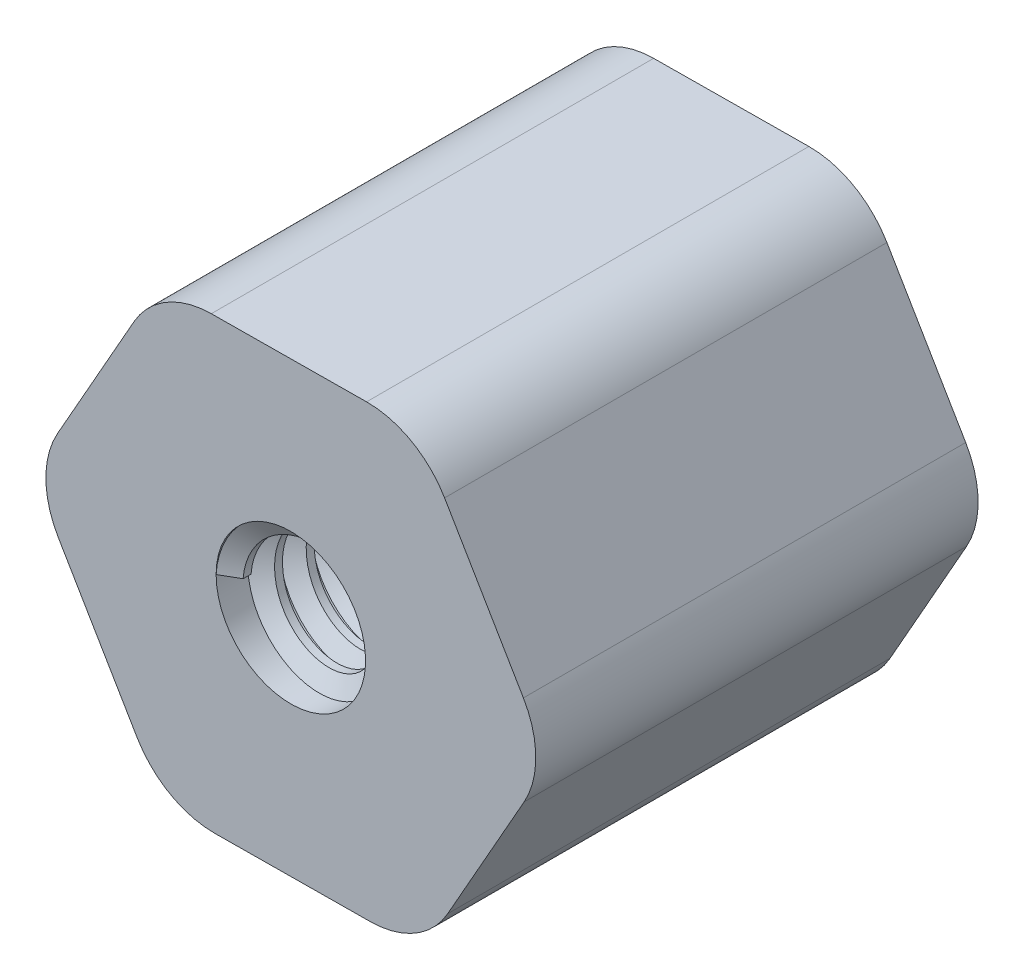
from build123d import *

# Parameters (mm, degrees)
CROQUIS1_R              = 2.5
SALIENTE_EXTRUIR1_DEPTH = 14.8
ROSCA1_PITCH            = 1.058333333


with BuildPart() as part:
    # Croquis1 → Saliente-Extruir1 (new body)
    with BuildSketch(Plane.XY):
        with BuildLine():
            Line((2.534265047, 7.52180169), (-2.661699853, 7.477656979))
            ThreePointArc((-2.661699853, 7.477656979), (-4.158231115, 7.063004214), (-5.246938823, 5.955638756))
            Line((-5.246938823, 5.955638756), (-7.806690831, 1.433728799))
            ThreePointArc((-7.806690831, 1.433728799), (-8.195856634, -0.069631673), (-7.78120387, -1.566162934))
            Line((-7.78120387, -1.566162934), (-5.144990978, -6.043928179))
            ThreePointArc((-5.144990978, -6.043928179), (-4.037625519, -7.132635887), (-2.534265047, -7.52180169))
            Line((-2.534265047, -7.52180169), (2.661699853, -7.477656979))
            ThreePointArc((2.661699853, -7.477656979), (4.158231115, -7.063004214), (5.246938823, -5.955638756))
            Line((5.246938823, -5.955638756), (7.806690831, -1.433728799))
            ThreePointArc((7.806690831, -1.433728799), (8.195856634, 0.069631673), (7.78120387, 1.566162934))
            Line((7.78120387, 1.566162934), (5.144990978, 6.043928179))
            ThreePointArc((5.144990978, 6.043928179), (4.037625519, 7.132635887), (2.534265047, 7.52180169))
        make_face()
        Circle(CROQUIS1_R, mode=Mode.SUBTRACT)
    extrude(amount=SALIENTE_EXTRUIR1_DEPTH)

    # Rosca1: the profile of Perfil de rosca2 profile screwed along a right-hand helix of 13.03937 turns, 8 arcs to a turn; built about Z, then put on its axis
    rosca1_z = Axis((0, 0, 0), (0, 0, 1))
    rosca1_corners = [(2.5003, 0, -0.000173205), (2.5003, 0, 0.926214869), (1.927160282, 0, 0.595312499), (1.927160282, 0, 0.330729165)]
    with BuildLine(mode=Mode.PRIVATE) as rosca1_profile:
        Line(rosca1_corners[0], rosca1_corners[1])
        Line(rosca1_corners[1], rosca1_corners[2])
        Line(rosca1_corners[2], rosca1_corners[3])
        Line(rosca1_corners[3], rosca1_corners[0])
    rosca1_cap = Face(rosca1_profile.wire())
    rosca1_turn_angles = [0, 22.5, 45, 67.5, 90, 112.5, 135, 157.5, 180, 202.5, 225, 247.5, 270, 292.5, 315, 337.5, 360]
    rosca1_turn_weights = [1, 0.9238795325112867, 1, 0.9238795325112867, 1, 0.9238795325112867, 1, 0.9238795325112867, 1, 0.9238795325112867, 1, 0.9238795325112867, 1, 0.9238795325112867, 1, 0.9238795325112867, 1]
    rosca1_turn_rails = [Edge.make_bspline([Vector(p[0], p[1], 0).rotate(rosca1_z, rosca1_turn_angles[k]) / rosca1_turn_weights[k] + Vector(0, 0, p[2] + ROSCA1_PITCH * rosca1_turn_angles[k] / 360) for k in range(17)], [0, 0, 0, 1, 1, 2, 2, 3, 3, 4, 4, 5, 5, 6, 6, 7, 7, 8, 8, 8], 2, rosca1_turn_weights) for p in rosca1_corners]
    rosca1_turn_sides = [Face.make_surface_from_curves(rosca1_turn_rails[p[0]], rosca1_turn_rails[p[1]]) for p in [(0, 1), (1, 2), (2, 3), (3, 0)]]
    rosca1_last_angles = [4680, 4687.086614173, 4694.173228346]
    rosca1_last_weights = [1, 0.9923607874151016, 1]
    rosca1_last_rails = [Edge.make_bspline([Vector(p[0], p[1], 0).rotate(rosca1_z, rosca1_last_angles[k]) / rosca1_last_weights[k] + Vector(0, 0, p[2] + ROSCA1_PITCH * rosca1_last_angles[k] / 360) for k in range(3)], [0, 0, 0, 1, 1, 1], 2, rosca1_last_weights) for p in rosca1_corners]
    rosca1_last_sides = [Face.make_surface_from_curves(rosca1_last_rails[p[0]], rosca1_last_rails[p[1]]) for p in [(0, 1), (1, 2), (2, 3), (3, 0)]]
    rosca1 = Plane(origin=(0, 0, 14.8), x_dir=(-1, 0, 0), z_dir=(0, 0, -1)) * Solid(Shell([*[p.moved(Location((0, 0, ROSCA1_PITCH * i))) for i in range(13) for p in rosca1_turn_sides], *rosca1_last_sides, rosca1_cap, rosca1_cap.rotate(rosca1_z, 4694.173228346).moved(Location((0, 0, ROSCA1_PITCH * 4694.173228346 / 360)))]))
    add(rosca1)


solid = part.part
